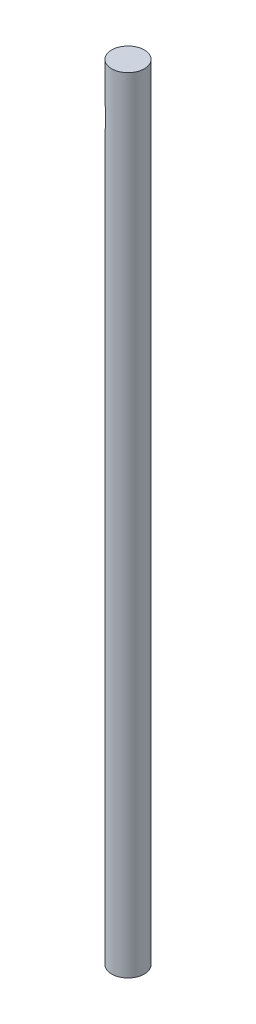
from build123d import *

# Parameters (mm, degrees)
SKETCH1_R           = 12.7
BOSS_EXTRUDE1_DEPTH = 609.6
SKETCH3_R           = 12.7
CUT_EXTRUDE1_DEPTH  = 6.35


with BuildPart() as part:
    # Sketch1 → Boss-Extrude1 (new body)
    with BuildSketch(Plane(origin=(0, 0, 0), x_dir=(1, 0, 0), z_dir=(0, 1, 0))):
        Circle(SKETCH1_R)
    extrude(amount=BOSS_EXTRUDE1_DEPTH)

    # Sketch3 → Cut-Extrude1 (cut)
    with BuildSketch(Plane.ZY.offset(12.7)):
        with Locations((0, 571.754)):
            Circle(SKETCH3_R)
    extrude(amount=-CUT_EXTRUDE1_DEPTH, mode=Mode.SUBTRACT)


solid = part.part
